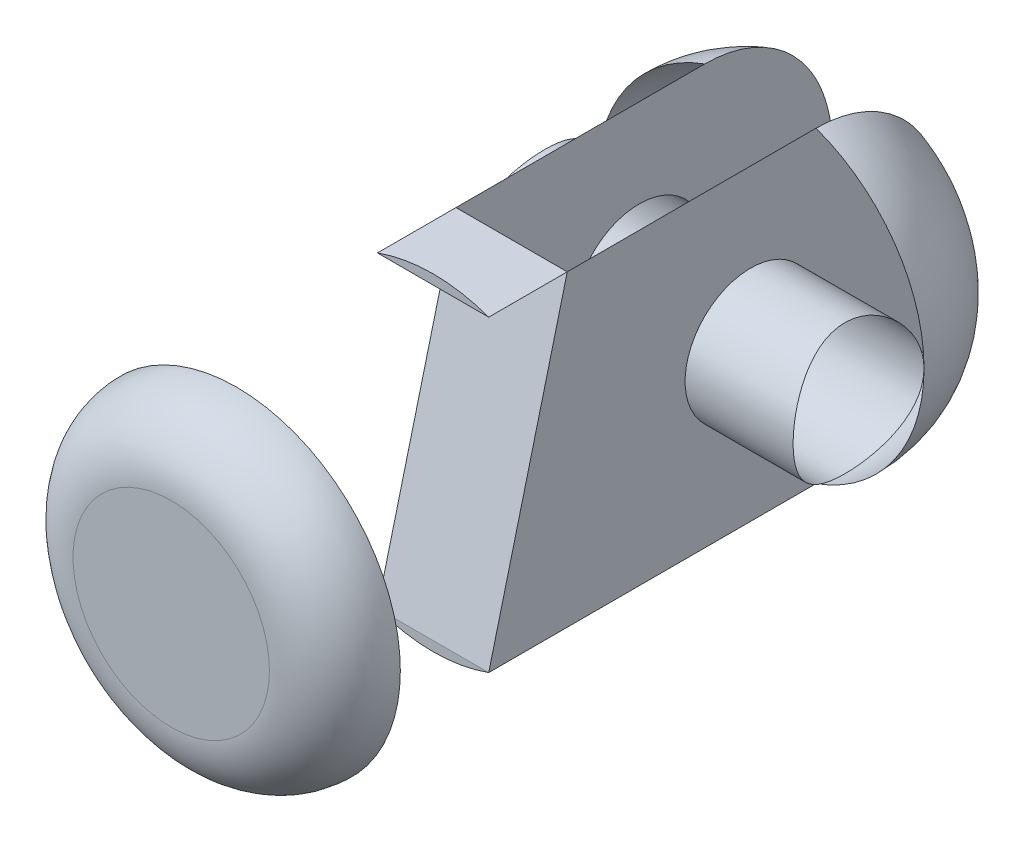
from build123d import *
from build123d.topology import SkipClean

# Parameters (mm, degrees)
ESQUISSE1_R                  = 2.5
BOSS_EXTRU_1_DEPTH           = 4
BOSS_EXTRU_2_START           = 7
BOSS_EXTRU_2_DEPTH           = 7
ENL_V_MAT_EXTRU_2_DEPTH      = 9.153066908
ENL_V_MAT_EXTRU_2_DEPTH_BACK = 9.153066908
ESQUISSE3_R                  = 1
CONG_1_R                     = 2
BOSS_EXTRU_3_REACH           = 10.127
CONG_2_R                     = 1


# Some blends are built 0.0001 mm under size
with BuildPart() as part:
    # Esquisse1 → Boss.-Extru.1 (new body)
    with BuildSketch(Plane.XY):
        Circle(ESQUISSE1_R)
    extrude(amount=BOSS_EXTRU_1_DEPTH)

    # Esquisse2 → Boss.-Extru.2 (add)
    with SkipClean():  # the faces are left unmerged after this step: merging them gives an invalid solid
        with BuildSketch(Plane(origin=(0, 0, 0), x_dir=(-1, 0, 0), z_dir=(0, 0, -1)).offset(BOSS_EXTRU_2_START)):
            with BuildLine():
                Line((0.85, -2.351063589), (0.85, 2.351063589))
                ThreePointArc((0.85, 2.351063589), (2.5, 0), (0.85, -2.351063589))
            make_face()
            with BuildLine():
                Line((-0.85, -2.351063589), (-0.85, 2.351063589))
                ThreePointArc((-0.85, 2.351063589), (-2.5, 0), (-0.85, -2.351063589))
            make_face()
        extrude(amount=-BOSS_EXTRU_2_DEPTH)

    # Esquisse3 → Enlèv. mat.-Extru.2 (cut, two sides: drawn at the far end of the back side and taken through both)
    with SkipClean():  # the faces are left unmerged after this step: merging them gives an invalid solid
        with BuildSketch(Plane.ZY.offset(-0.85).offset(-ENL_V_MAT_EXTRU_2_DEPTH_BACK)):
            with Locations((-4, 0)):
                Circle(ESQUISSE3_R)
        extrude(amount=ENL_V_MAT_EXTRU_2_DEPTH + ENL_V_MAT_EXTRU_2_DEPTH_BACK, mode=Mode.SUBTRACT)

    # Congé1
    # the kernel refuses this fillet: 2 mm, written as the material it takes off along each edge
    with BuildSketch(Plane(origin=(0, 0, -7), x_dir=(0.9999950652018581, 0.003141587485879649, 0), z_dir=(0.003141587485879649, -0.9999950652018581, 0))) as cong_1_piece_1:
        with BuildLine():
            CenterArc((2.5 - CONG_1_R, CONG_1_R), CONG_1_R, 270, 90)
            Line((2.5 - CONG_1_R, 0), (2.5, 0))
            Line((2.5, 0), (2.5, CONG_1_R))
        make_face()
    revolve(axis=Axis((0, 0, -7), (0, 0, 1)), revolution_arc=359.64, mode=Mode.SUBTRACT)
    with BuildSketch(Plane(origin=(0, 0, -7), x_dir=(-0.9999950652018581, 0.003141587485879604, 0), z_dir=(-0.003141587485879604, -0.9999950652018581, 0))) as cong_1_piece_2:
        with BuildLine():
            CenterArc((2.5 - CONG_1_R, -CONG_1_R), CONG_1_R, 0, 90)
            Line((2.5 - CONG_1_R, 0), (2.5, 0))
            Line((2.5, 0), (2.5, -CONG_1_R))
        make_face()
    revolve(axis=Axis((0, 0, -7), (0, 0, -1)), revolution_arc=359.64, mode=Mode.SUBTRACT)

    # Esquisse4 → Boss.-Extru.3 (add, up to next)
    with BuildSketch(Plane(origin=(-0.85, 0, 0), x_dir=(0, 0, -1), z_dir=(1, 0, 0)), mode=Mode.PRIVATE) as boss_extru_3_sk1:
        Polygon((0, -2.351063589), (1.2, 2.351063589), (0, 2.351063589), align=None)
    boss_extru_3_tool1 = extrude(boss_extru_3_sk1.sketch, amount=BOSS_EXTRU_3_REACH, mode=Mode.PRIVATE) - part.part
    add(boss_extru_3_tool1.solids().sort_by_distance((-0.85, 0.783688, -0.4))[0])

    # Congé2
    cong_2_edges = [part.edges().sort_by_distance(p)[0] for p in [
        (-2.5, 0, 4),
    ]]
    fillet(cong_2_edges, radius=CONG_2_R - 0.0001)  # a hair under: the kernel refuses the full size


solid = part.part
